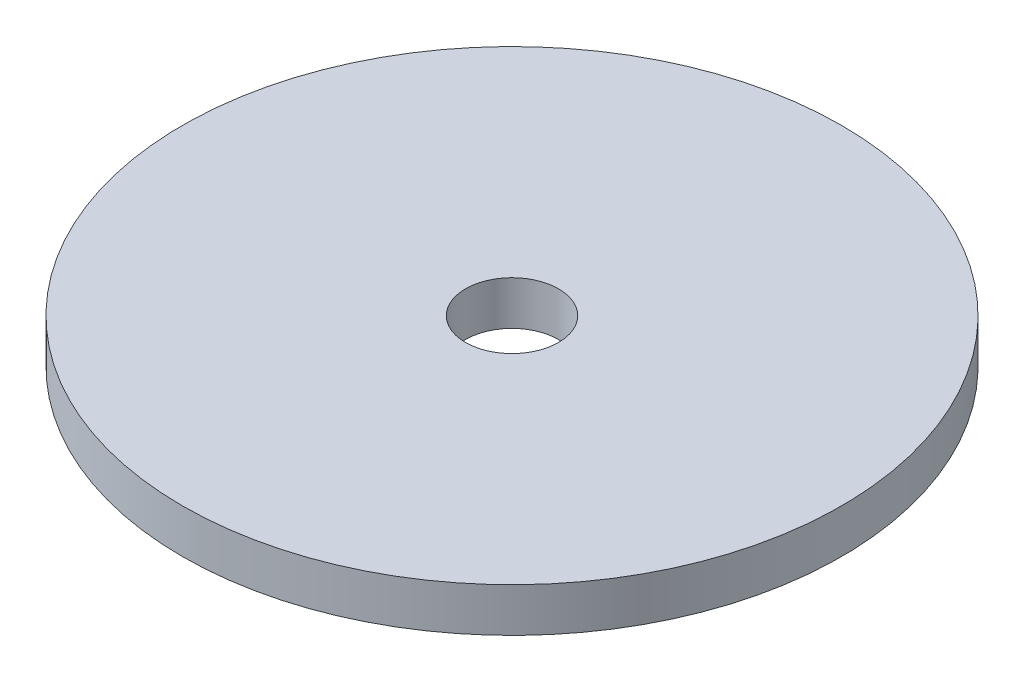
from build123d import *

# Parameters (mm, degrees)
SKETCH1_R           = 22.5
SKETCH1_R_2         = 3.175
BOSS_EXTRUDE1_DEPTH = 3


with BuildPart() as part:
    # Sketch1 → Boss-Extrude1 (new body)
    with BuildSketch(Plane(origin=(0, 0, 0), x_dir=(1, 0, 0), z_dir=(0, 1, 0))):
        Circle(SKETCH1_R)
        Circle(SKETCH1_R_2, mode=Mode.SUBTRACT)
    extrude(amount=-BOSS_EXTRUDE1_DEPTH)


solid = part.part
